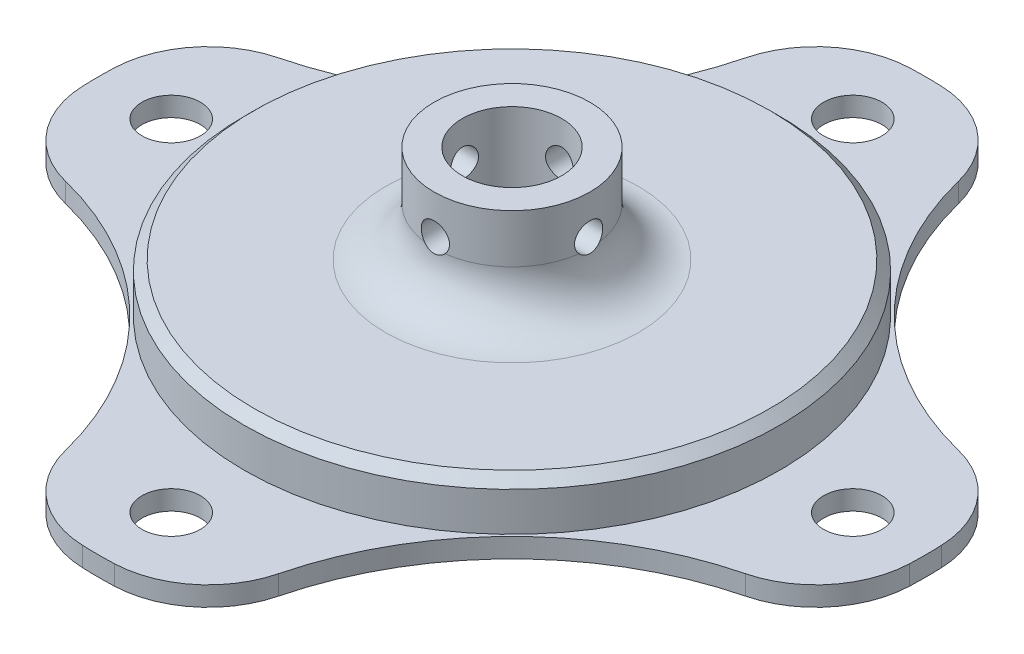
from build123d import *

# Parameters (mm, degrees)
SKETCH1_R           = 27.5
BOSS_EXTRUDE1_DEPTH = 5
SKETCH2_R           = 42.5
BOSS_EXTRUDE2_DEPTH = 2
SKETCH3_R           = 3
CUT_EXTRUDE1_DEPTH  = 2
FILLET1_R           = 10
SKETCH6_R           = 8
BOSS_EXTRUDE3_DEPTH = 10
FILLET2_R           = 5
SKETCH7_R           = 5.1
CUT_EXTRUDE4_DEPTH  = 20
SKETCH10_R          = 1.45
CUT_EXTRUDE5_DEPTH  = 61.930288174
CIRPATTERN1_COUNT   = 4
CHAMFER1_SIZE       = 1


with BuildPart() as part:
    # Sketch1 → Boss-Extrude1 (new body)
    with BuildSketch(Plane(origin=(0, 0, 0), x_dir=(1, 0, 0), z_dir=(0, 1, 0))):
        Circle(SKETCH1_R)
    extrude(amount=-BOSS_EXTRUDE1_DEPTH)

    # Sketch2 → Boss-Extrude2 (add)
    with BuildSketch(Plane.XZ.offset(5)):
        Circle(SKETCH2_R)
    extrude(amount=BOSS_EXTRUDE2_DEPTH)

    # Sketch3 → Cut-Extrude1 (cut)
    with BuildSketch(Plane(origin=(0, -5, 0), x_dir=(1, 0, 0), z_dir=(0, 1, 0))):
        with Locations((0, 35)):
            Circle(SKETCH3_R)
        with Locations((35, 0)):
            Circle(SKETCH3_R)
        with Locations((0, -35)):
            Circle(SKETCH3_R)
        with Locations((-35, 0)):
            Circle(SKETCH3_R)
        with BuildLine():
            ThreePointArc((-41.306779105, 10), (-19.624107624, 19.624107624), (-10, 41.306779105))
            ThreePointArc((-10, 41.306779105), (-30.0520382, 30.0520382), (-41.306779105, 10))
        make_face()
        with BuildLine():
            ThreePointArc((41.306779105, 10), (30.0520382, 30.0520382), (10, 41.306779105))
            ThreePointArc((10, 41.306779105), (19.624107624, 19.624107624), (41.306779105, 10))
        make_face()
        with BuildLine():
            ThreePointArc((-10, -41.306779105), (-19.624107624, -19.624107624), (-41.306779105, -10))
            ThreePointArc((-41.306779105, -10), (-30.0520382, -30.0520382), (-10, -41.306779105))
        make_face()
        with BuildLine():
            ThreePointArc((41.306779105, -10), (19.624107624, -19.624107624), (10, -41.306779105))
            ThreePointArc((10, -41.306779105), (30.0520382, -30.0520382), (41.306779105, -10))
        make_face()
    extrude(amount=-CUT_EXTRUDE1_DEPTH, mode=Mode.SUBTRACT)

    # Fillet1
    fillet1_edges = [part.edges().sort_by_distance(p)[0] for p in [
        (10, -6, -41.306779105),
        (-10, -6, -41.306779105),
        (-41.306779105, -6, -10),
        (-41.306779105, -6, 10),
        (10, -6, 41.306779105),
        (-10, -6, 41.306779105),
        (41.306779105, -6, 10),
        (41.306779105, -6, -10),
    ]]
    fillet(fillet1_edges, radius=FILLET1_R)

    # Sketch6 → Boss-Extrude3 (add)
    with BuildSketch(Plane(origin=(0, 0, 0), x_dir=(1, 0, 0), z_dir=(0, 1, 0))):
        Circle(SKETCH6_R)
    extrude(amount=BOSS_EXTRUDE3_DEPTH)

    # Fillet2
    fillet2_edges = [part.edges().sort_by_distance(p)[0] for p in [
        (-8, 0, 0),
    ]]
    fillet(fillet2_edges, radius=FILLET2_R)

    # Sketch7 → Cut-Extrude4 (cut)
    with BuildSketch(Plane(origin=(0, 10, 0), x_dir=(1, 0, 0), z_dir=(0, 1, 0))):
        Circle(SKETCH7_R)
    extrude(amount=-CUT_EXTRUDE4_DEPTH, mode=Mode.SUBTRACT)

    # Sketch10 → Cut-Extrude5 (cut, symmetric)
    with BuildSketch(Plane.XY):
        with Locations((0, 6)):
            Circle(SKETCH10_R)
    cut_extrude5 = extrude(amount=CUT_EXTRUDE5_DEPTH, both=True, mode=Mode.SUBTRACT)

    # CirPattern1: Cut-Extrude5 ×4 about axis
    cirpattern1_axis = Axis((0, 10, 0), (0, -1, 0))
    for i in range(1, CIRPATTERN1_COUNT):
        add(cut_extrude5.rotate(cirpattern1_axis, i * 360 / CIRPATTERN1_COUNT), mode=Mode.SUBTRACT)

    # Chamfer1
    chamfer1_edges = [part.edges().sort_by_distance(p)[0] for p in [
        (-27.5, 0, 0),
    ]]
    chamfer(chamfer1_edges, length=CHAMFER1_SIZE)


solid = part.part
